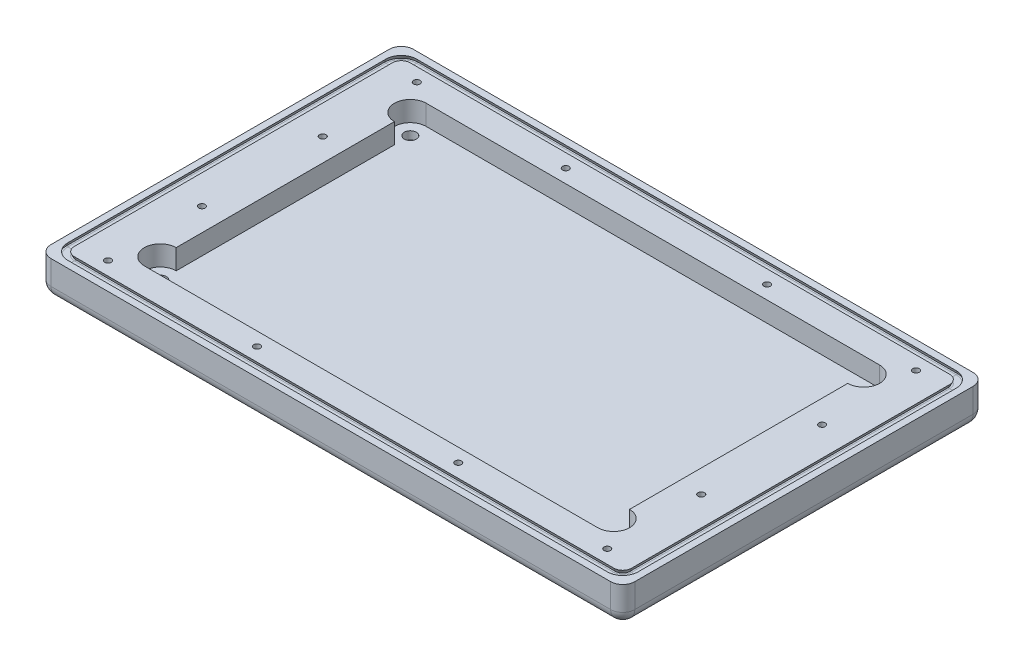
from build123d import *

# Parameters (mm, degrees)
SKETCH1_W               = 145
SKETCH1_H               = 90
BOSS_EXTRUDE1_DEPTH     = 4
SKETCH3_W               = 145
SKETCH3_H               = 90
SKETCH3_W_2             = 135
SKETCH3_H_2             = 80
BOSS_EXTRUDE2_DEPTH     = 5
BOSS_EXTRUDE4_DEPTH     = 5
FILLET1_R               = 3
FILLET3_R               = 3
FILLET4_R               = 3
FILLET5_R               = 3
FILLET6_R               = 3
CUT_EXTRUDE1_DEPTH      = 2
SKETCH11_R              = 2.5
CUT_EXTRUDE2_DEPTH      = 6
M2X0_4_TAPPED_HOLE1_D   = 1.6
MIRROR5_COPY_1_SKETCH_R = 2.5
MIRROR5_COPY_1_DEPTH    = 6
MIRROR5_COPY_2_D        = 1.6


with BuildPart() as part:
    # Sketch1 → Boss-Extrude1 (new body)
    with BuildSketch(Plane(origin=(0, 0, 0), x_dir=(1, 0, 0), z_dir=(0, 1, 0))):
        with Locations((72.5, 45)):
            Rectangle(SKETCH1_W, SKETCH1_H)
    extrude(amount=BOSS_EXTRUDE1_DEPTH)

    # Sketch3 → Boss-Extrude2 (add)
    with BuildSketch(Plane(origin=(0, 4, 0), x_dir=(1, 0, 0), z_dir=(0, 1, 0))):
        with Locations((72.5, 45)):
            Rectangle(SKETCH3_W, SKETCH3_H)
        with Locations((72.5, 45)):
            Rectangle(SKETCH3_W_2, SKETCH3_H_2, mode=Mode.SUBTRACT)
    extrude(amount=BOSS_EXTRUDE2_DEPTH)

    # Sketch5<4> → Boss-Extrude4 (add)
    with BuildSketch(Plane(origin=(0, 4, 0), x_dir=(1, 0, 0), z_dir=(0, 1, 0))):
        with BuildLine():
            Line((72.5, 80), (72.5, 85))
            Line((72.5, 85), (5, 85))
            Line((5, 85), (5, 45))
            Line((5, 45), (16.2, 45))
            Line((16.2, 45), (16.2, 72.1))
            ThreePointArc((16.2, 72.1), (12.25, 76.05), (16.2, 80))
            Line((16.2, 80), (72.5, 80))
        make_face()
        with BuildLine():
            Line((16.2, 45), (5, 45))
            Line((5, 45), (5, 5))
            Line((5, 5), (72.5, 5))
            Line((72.5, 5), (72.5, 10))
            Line((72.5, 10), (16.2, 10))
            ThreePointArc((16.2, 10), (12.25, 13.95), (16.2, 17.9))
            Line((16.2, 17.9), (16.2, 45))
        make_face()
        with BuildLine():
            Line((140, 5), (140, 45))
            Line((140, 45), (128.8, 45))
            Line((128.8, 45), (128.8, 17.9))
            ThreePointArc((128.8, 17.9), (131.593071786, 16.743071786), (132.75, 13.95))
            ThreePointArc((132.75, 13.95), (131.593071786, 11.156928214), (128.8, 10))
            Line((128.8, 10), (72.5, 10))
            Line((72.5, 10), (72.5, 5))
            Line((72.5, 5), (140, 5))
        make_face()
        with BuildLine():
            Line((140, 85), (72.5, 85))
            Line((72.5, 85), (72.5, 80))
            Line((72.5, 80), (128.8, 80))
            ThreePointArc((128.8, 80), (131.593071786, 78.843071786), (132.75, 76.05))
            ThreePointArc((132.75, 76.05), (131.593071786, 73.256928214), (128.8, 72.1))
            Line((128.8, 72.1), (128.8, 45))
            Line((128.8, 45), (140, 45))
            Line((140, 45), (140, 85))
        make_face()
    extrude(amount=BOSS_EXTRUDE4_DEPTH)

    # Fillet1
    fillet1_edges = [part.edges().sort_by_distance(p)[0] for p in [
        (72.5, 0, -90),
        (145, 0, -45),
        (72.5, 0, 0),
        (0, 0, -45),
    ]]
    fillet(fillet1_edges, radius=FILLET1_R)

    # Fillet3
    # the kernel refuses this fillet: 3 mm, written as the material it takes off along each edge
    with BuildSketch(Plane(origin=(3, 3, -87), x_dir=(0, 0, -1), z_dir=(-1, 0, 0))) as fillet3_piece_1_section:
        Polygon((0, 0), (FILLET3_R, 0), (FILLET3_R, FILLET3_R), (0, FILLET3_R), align=None)
    fillet3_piece_1 = extrude(amount=FILLET3_R, mode=Mode.PRIVATE)
    fillet3_piece_1 = fillet3_piece_1 - Plane(origin=(3, 3, -87), x_dir=(0, 0.7071067811865475, 0.7071067811865475), z_dir=(-1, 0, 0)) * Sphere(FILLET3_R, mode=Mode.PRIVATE)
    add(fillet3_piece_1, mode=Mode.SUBTRACT)
    with BuildSketch(Plane(origin=(0, 16.5, -90), x_dir=(0, 0, 1), z_dir=(0, -1, 0))) as fillet3_piece_2:
        with BuildLine():
            CenterArc((FILLET3_R, -FILLET3_R), FILLET3_R, 90, 90)
            Line((0, -FILLET3_R), (0, 0))
            Line((0, 0), (FILLET3_R, 0))
        make_face()
    extrude(amount=13.5, mode=Mode.SUBTRACT)

    # Fillet4
    # the kernel refuses this fillet: 3 mm, written as the material it takes off along each edge
    with BuildSketch(Plane(origin=(142, 3, -87), x_dir=(0, 0, -1), z_dir=(1, 0, 0))) as fillet4_piece_1_section:
        Polygon((0, 0), (FILLET4_R, 0), (FILLET4_R, -FILLET4_R), (0, -FILLET4_R), align=None)
    fillet4_piece_1 = extrude(amount=FILLET4_R, mode=Mode.PRIVATE)
    fillet4_piece_1 = fillet4_piece_1 - Plane(origin=(142, 3, -87), x_dir=(0, 0.7071067811865475, 0.7071067811865475), z_dir=(1, 0, 0)) * Sphere(FILLET4_R, mode=Mode.PRIVATE)
    add(fillet4_piece_1, mode=Mode.SUBTRACT)
    with BuildSketch(Plane(origin=(145, 3, -90), x_dir=(0, 0, 1), z_dir=(0, 1, 0))) as fillet4_piece_2:
        with BuildLine():
            CenterArc((FILLET4_R, -FILLET4_R), FILLET4_R, 90, 90)
            Line((0, -FILLET4_R), (0, 0))
            Line((0, 0), (FILLET4_R, 0))
        make_face()
    extrude(amount=13.5, mode=Mode.SUBTRACT)

    # Fillet5
    # the kernel refuses this fillet: 3 mm, written as the material it takes off along each edge
    with BuildSketch(Plane(origin=(142, 3, -3), x_dir=(1, 0, 0), z_dir=(0, 0, 1))) as fillet5_piece_1_section:
        Polygon((0, 0), (FILLET5_R, 0), (FILLET5_R, -FILLET5_R), (0, -FILLET5_R), align=None)
    fillet5_piece_1 = extrude(amount=FILLET5_R, mode=Mode.PRIVATE)
    fillet5_piece_1 = fillet5_piece_1 - Plane(origin=(142, 3, -3), x_dir=(-0.7071067811865475, 0.7071067811865475, 0), z_dir=(0, 0, 1)) * Sphere(FILLET5_R, mode=Mode.PRIVATE)
    add(fillet5_piece_1, mode=Mode.SUBTRACT)
    with BuildSketch(Plane(origin=(145, 3, 0), x_dir=(-1, 0, 0), z_dir=(0, 1, 0))) as fillet5_piece_2:
        with BuildLine():
            CenterArc((FILLET5_R, -FILLET5_R), FILLET5_R, 90, 90)
            Line((0, -FILLET5_R), (0, 0))
            Line((0, 0), (FILLET5_R, 0))
        make_face()
    extrude(amount=13.5, mode=Mode.SUBTRACT)

    # Fillet6
    # the kernel refuses this fillet: 3 mm, written as the material it takes off along each edge
    with BuildSketch(Plane(origin=(3, 3, -3), x_dir=(-1, 0, 0), z_dir=(0, 0, 1))) as fillet6_piece_1_section:
        Polygon((0, 0), (FILLET6_R, 0), (FILLET6_R, FILLET6_R), (0, FILLET6_R), align=None)
    fillet6_piece_1 = extrude(amount=FILLET6_R, mode=Mode.PRIVATE)
    fillet6_piece_1 = fillet6_piece_1 - Plane(origin=(3, 3, -3), x_dir=(0.7071067811865475, 0.7071067811865475, 0), z_dir=(0, 0, 1)) * Sphere(FILLET6_R, mode=Mode.PRIVATE)
    add(fillet6_piece_1, mode=Mode.SUBTRACT)
    with BuildSketch(Plane(origin=(0, 16.5, 0), x_dir=(1, 0, 0), z_dir=(0, -1, 0))) as fillet6_piece_2:
        with BuildLine():
            CenterArc((FILLET6_R, -FILLET6_R), FILLET6_R, 90, 90)
            Line((0, -FILLET6_R), (0, 0))
            Line((0, 0), (FILLET6_R, 0))
        make_face()
    extrude(amount=13.5, mode=Mode.SUBTRACT)

    # Sketch5 → Cut-Extrude1 (cut)
    with BuildSketch(Plane(origin=(0, 4, 0), x_dir=(1, 0, 0), z_dir=(0, 1, 0))):
        with BuildLine():
            ThreePointArc((130.3, 13.95), (129.860660172, 15.010660172), (128.8, 15.45))
            Line((128.8, 15.45), (128.8, 13.95))
            Line((128.8, 13.95), (127.3, 13.95))
            ThreePointArc((127.3, 13.95), (128.8, 12.45), (130.3, 13.95))
        make_face()
        with BuildLine():
            Line((128.8, 13.95), (128.8, 15.45))
            ThreePointArc((128.8, 15.45), (127.739339828, 15.010660172), (127.3, 13.95))
            Line((127.3, 13.95), (128.8, 13.95))
        make_face()
        with BuildLine():
            ThreePointArc((130.3, 76.05), (128.8, 77.55), (127.3, 76.05))
            Line((127.3, 76.05), (128.8, 76.05))
            Line((128.8, 76.05), (128.8, 74.55))
            ThreePointArc((128.8, 74.55), (129.860660172, 74.989339828), (130.3, 76.05))
        make_face()
        with BuildLine():
            Line((128.8, 76.05), (127.3, 76.05))
            ThreePointArc((127.3, 76.05), (127.739339828, 74.989339828), (128.8, 74.55))
            Line((128.8, 74.55), (128.8, 76.05))
        make_face()
        with BuildLine():
            ThreePointArc((16.2, 74.55), (17.260660172, 74.989339828), (17.7, 76.05))
            Line((17.7, 76.05), (16.2, 76.05))
            Line((16.2, 76.05), (16.2, 74.55))
        make_face()
        with BuildLine():
            Line((16.2, 76.05), (17.7, 76.05))
            ThreePointArc((17.7, 76.05), (15.139339828, 77.110660172), (16.2, 74.55))
            Line((16.2, 74.55), (16.2, 76.05))
        make_face()
        with BuildLine():
            ThreePointArc((17.7, 13.95), (17.260660172, 15.010660172), (16.2, 15.45))
            Line((16.2, 15.45), (16.2, 13.95))
            Line((16.2, 13.95), (17.7, 13.95))
        make_face()
        with BuildLine():
            Line((16.2, 13.95), (16.2, 15.45))
            ThreePointArc((16.2, 15.45), (15.139339828, 12.889339828), (17.7, 13.95))
            Line((17.7, 13.95), (16.2, 13.95))
        make_face()
    extrude(amount=-CUT_EXTRUDE1_DEPTH, mode=Mode.SUBTRACT)

    # Sketch11 → Cut-Extrude2 (cut)
    with BuildSketch(Plane.XZ):
        with Locations(Location((10.5, -83.35, 0), (0, 0, 270))):
            Circle(SKETCH11_R)
        with Locations(Location((47.5, -83.35, 0), (0, 0, 270))):
            Circle(SKETCH11_R)
        with Locations(Location((10.5, -60, 0), (0, 0, 270))):
            Circle(SKETCH11_R)
    cut_extrude2 = extrude(amount=-CUT_EXTRUDE2_DEPTH, mode=Mode.SUBTRACT)

    # M2x0.4 Tapped Hole1 (through all)
    with Locations(Plane(origin=(0, 0, 0), x_dir=(-1, 0, 0), z_dir=(0, -1, 0))):
        with Locations((-10.5, 60), (-47.5, 83.35), (-10.5, 83.35)):
            m2x0_4_tapped_hole1 = Hole(M2X0_4_TAPPED_HOLE1_D / 2)

    # Cut-Sweep1: sweep along a path in Sketch6
    with BuildLine(Plane(origin=(0, 9, 0), x_dir=(1, 0, 0), z_dir=(0, 1, 0))) as cut_sweep1_path:
        Line((139.5, 87.5), (5.5, 87.5))
        ThreePointArc((5.5, 87.5), (3.378679656, 86.621320344), (2.5, 84.5))
        Line((2.5, 84.5), (2.5, 5.5))
        ThreePointArc((2.5, 5.5), (3.378679656, 3.378679656), (5.5, 2.5))
        Line((5.5, 2.5), (139.5, 2.5))
        ThreePointArc((139.5, 2.5), (141.621320344, 3.378679656), (142.5, 5.5))
        Line((142.5, 5.5), (142.5, 84.5))
        ThreePointArc((142.5, 84.5), (141.621320344, 86.621320344), (139.5, 87.5))
    # Sketch7 → Cut-Sweep1 (sweep, cut)
    with BuildSketch(Plane(origin=(5.5, 0, 0), x_dir=(0, 0, -1), z_dir=(1, 0, 0))):
        Polygon((1.7, 9), (3.3, 9), (3.700705817, 8.1), (3.3, 8.1), (1.7, 8.1), (1.299294183, 8.1), align=None)
    sweep(path=cut_sweep1_path.line, mode=Mode.SUBTRACT)

    # Mirror4: Cut-Extrude2, M2x0.4 Tapped Hole1 across plane
    add(cut_extrude2.mirror(Plane(origin=(72.5, 0, 0), x_dir=(0, 0, 1), z_dir=(1, 0, 0))), mode=Mode.SUBTRACT)
    add(m2x0_4_tapped_hole1.mirror(Plane(origin=(72.5, 0, 0), x_dir=(0, 0, 1), z_dir=(1, 0, 0))), mode=Mode.SUBTRACT)

    # Mirror5: Cut-Extrude2, M2x0.4 Tapped Hole1 across plane
    add(cut_extrude2.mirror(Plane.XY.offset(-45)), mode=Mode.SUBTRACT)
    add(m2x0_4_tapped_hole1.mirror(Plane.XY.offset(-45)), mode=Mode.SUBTRACT)

    # Mirror5 copy 1 sketch → Mirror5 copy 1 (cut)
    with BuildSketch(Plane(origin=(145, 0, -90), x_dir=(-1, 0, 0), z_dir=(0, -1, 0))):
        with Locations(Location((10.5, -83.35, 0), (0, 0, 270))):
            Circle(MIRROR5_COPY_1_SKETCH_R)
        with Locations(Location((47.5, -83.35, 0), (0, 0, 270))):
            Circle(MIRROR5_COPY_1_SKETCH_R)
        with Locations(Location((10.5, -60, 0), (0, 0, 270))):
            Circle(MIRROR5_COPY_1_SKETCH_R)
    extrude(amount=-MIRROR5_COPY_1_DEPTH, mode=Mode.SUBTRACT)

    # Mirror5 copy 2 (through all)
    with Locations(Plane(origin=(145, 0, -90), x_dir=(1, 0, 0), z_dir=(0, -1, 0))):
        with Locations((-10.5, 60), (-47.5, 83.35), (-10.5, 83.35)):
            Hole(MIRROR5_COPY_2_D / 2)


solid = part.part
